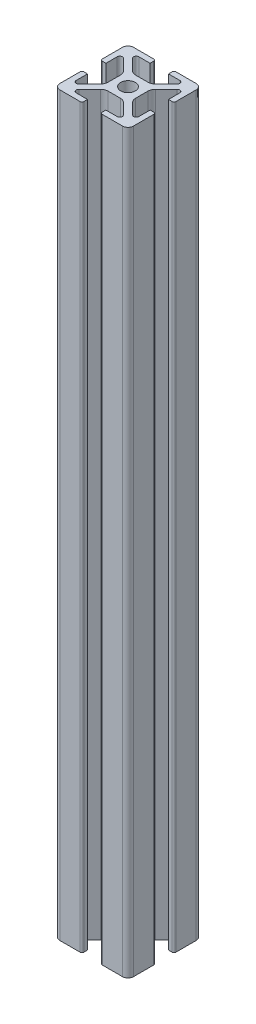
from build123d import *

# Parameters (mm, degrees)
ESQUISSE1_R        = 2
BOSS_EXTRU_1_DEPTH = 200


with BuildPart() as part:
    # Esquisse1 → Boss.-Extru.1 (new body)
    with BuildSketch(Plane(origin=(0, 0, 0), x_dir=(1, 0, 0), z_dir=(0, 1, 0))):
        with BuildLine():
            Line((-5.649708969, 9.692729836), (-5.649708969, 4.192729836))
            ThreePointArc((-5.649708969, 4.192729836), (-5.503262359, 3.839176445), (-5.149708969, 3.692729836))
            Line((-5.149708969, 3.692729836), (-4.149708969, 3.692729836))
            Line((-4.149708969, 3.692729836), (-4.149708969, 6.752780342))
            ThreePointArc((-4.149708969, 6.752780342), (-3.717587371, 7.399496015), (-2.954734222, 7.247755089))
            Line((-2.954734222, 7.247755089), (0.014504594, 4.278516274))
            ThreePointArc((0.014504594, 4.278516274), (0.448050096, 3.629669576), (0.600291031, 2.864302711))
            Line((0.600291031, 2.864302711), (0.600291031, -0.478843039))
            ThreePointArc((0.600291031, -0.478843039), (0.448050096, -1.244209904), (0.014504594, -1.893056602))
            Line((0.014504594, -1.893056602), (-2.954734222, -4.862295417))
            ThreePointArc((-2.954734222, -4.862295417), (-3.717587371, -5.014036343), (-4.149708969, -4.36732067))
            Line((-4.149708969, -4.36732067), (-4.149708969, -1.307270164))
            Line((-4.149708969, -1.307270164), (-5.149708969, -1.307270164))
            ThreePointArc((-5.149708969, -1.307270164), (-5.503262359, -1.453716774), (-5.649708969, -1.807270164))
            Line((-5.649708969, -1.807270164), (-5.649708969, -7.307270164))
            ThreePointArc((-5.649708969, -7.307270164), (-5.21036914, -8.367930336), (-4.149708969, -8.807270164))
            Line((-4.149708969, -8.807270164), (1.350291031, -8.807270164))
            ThreePointArc((1.350291031, -8.807270164), (1.703844422, -8.660823555), (1.850291031, -8.307270164))
            Line((1.850291031, -8.307270164), (1.850291031, -7.307270164))
            Line((1.850291031, -7.307270164), (-1.209759475, -7.307270164))
            ThreePointArc((-1.209759475, -7.307270164), (-1.856475148, -6.875148567), (-1.704734222, -6.112295417))
            Line((-1.704734222, -6.112295417), (1.264504594, -3.143056602))
            ThreePointArc((1.264504594, -3.143056602), (1.913351291, -2.709511099), (2.678718156, -2.557270164))
            Line((2.678718156, -2.557270164), (6.021863907, -2.557270164))
            ThreePointArc((6.021863907, -2.557270164), (6.787230771, -2.709511099), (7.436077469, -3.143056602))
            Line((7.436077469, -3.143056602), (10.405316285, -6.112295417))
            ThreePointArc((10.405316285, -6.112295417), (10.557057211, -6.875148567), (9.910341538, -7.307270164))
            Line((9.910341538, -7.307270164), (6.850291031, -7.307270164))
            Line((6.850291031, -7.307270164), (6.850291031, -8.307270164))
            ThreePointArc((6.850291031, -8.307270164), (6.996737641, -8.660823555), (7.350291031, -8.807270164))
            Line((7.350291031, -8.807270164), (12.850291031, -8.807270164))
            ThreePointArc((12.850291031, -8.807270164), (13.910951203, -8.367930336), (14.350291031, -7.307270164))
            Line((14.350291031, -7.307270164), (14.350291031, -1.807270164))
            ThreePointArc((14.350291031, -1.807270164), (14.203844422, -1.453716774), (13.850291031, -1.307270164))
            Line((13.850291031, -1.307270164), (12.850291031, -1.307270164))
            Line((12.850291031, -1.307270164), (12.850291031, -4.36732067))
            ThreePointArc((12.850291031, -4.36732067), (12.418169434, -5.014036343), (11.655316285, -4.862295417))
            Line((11.655316285, -4.862295417), (8.686077469, -1.893056602))
            ThreePointArc((8.686077469, -1.893056602), (8.252531966, -1.244209904), (8.100291031, -0.478843039))
            Line((8.100291031, -0.478843039), (8.100291031, 2.864302711))
            ThreePointArc((8.100291031, 2.864302711), (8.252531966, 3.629669576), (8.686077469, 4.278516274))
            Line((8.686077469, 4.278516274), (11.655316285, 7.247755089))
            ThreePointArc((11.655316285, 7.247755089), (12.418169434, 7.399496015), (12.850291031, 6.752780342))
            Line((12.850291031, 6.752780342), (12.850291031, 3.692729836))
            Line((12.850291031, 3.692729836), (13.850291031, 3.692729836))
            ThreePointArc((13.850291031, 3.692729836), (14.203844422, 3.839176445), (14.350291031, 4.192729836))
            Line((14.350291031, 4.192729836), (14.350291031, 9.692729836))
            ThreePointArc((14.350291031, 9.692729836), (13.910951203, 10.753390008), (12.850291031, 11.192729836))
            Line((12.850291031, 11.192729836), (7.350291031, 11.192729836))
            ThreePointArc((7.350291031, 11.192729836), (6.996737641, 11.046283226), (6.850291031, 10.692729836))
            Line((6.850291031, 10.692729836), (6.850291031, 9.692729836))
            Line((6.850291031, 9.692729836), (9.910341538, 9.692729836))
            ThreePointArc((9.910341538, 9.692729836), (10.557057211, 9.260608239), (10.405316285, 8.497755089))
            Line((10.405316285, 8.497755089), (7.436077469, 5.528516274))
            ThreePointArc((7.436077469, 5.528516274), (6.787230771, 5.094970771), (6.021863907, 4.942729836))
            Line((6.021863907, 4.942729836), (2.678718156, 4.942729836))
            ThreePointArc((2.678718156, 4.942729836), (1.913351291, 5.094970771), (1.264504594, 5.528516274))
            Line((1.264504594, 5.528516274), (-1.704734222, 8.497755089))
            ThreePointArc((-1.704734222, 8.497755089), (-1.856475148, 9.260608239), (-1.209759475, 9.692729836))
            Line((-1.209759475, 9.692729836), (1.850291031, 9.692729836))
            Line((1.850291031, 9.692729836), (1.850291031, 10.692729836))
            ThreePointArc((1.850291031, 10.692729836), (1.703844422, 11.046283226), (1.350291031, 11.192729836))
            Line((1.350291031, 11.192729836), (-4.149708969, 11.192729836))
            ThreePointArc((-4.149708969, 11.192729836), (-5.21036914, 10.753390008), (-5.649708969, 9.692729836))
        make_face()
        with Locations((4.350291031, 1.192729836)):
            Circle(ESQUISSE1_R, mode=Mode.SUBTRACT)
    extrude(amount=BOSS_EXTRU_1_DEPTH)


solid = part.part
